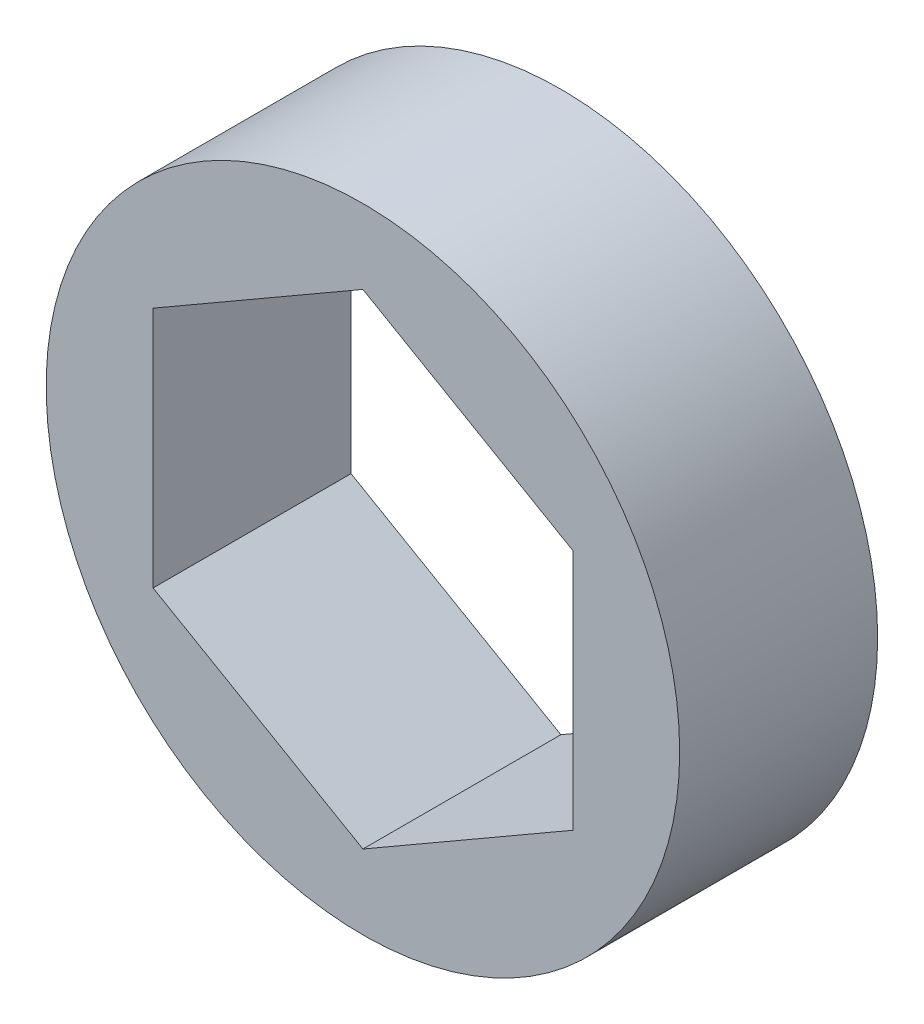
from build123d import *

# Parameters (mm, degrees)
SKETCH1_R           = 10.16
BOSS_EXTRUDE1_DEPTH = 3.175


with BuildPart() as part:
    # Sketch1 → Boss-Extrude1 (new, symmetric)
    with BuildSketch(Plane.XY):
        Circle(SKETCH1_R)
        Polygon((0, 7.772289324), (-6.731, 3.886144662), (-6.731, -3.886144662), (0, -7.772289324), (6.731, -3.886144662), (6.731, 3.886144662), align=None, mode=Mode.SUBTRACT)
    extrude(amount=BOSS_EXTRUDE1_DEPTH, both=True)


solid = part.part
